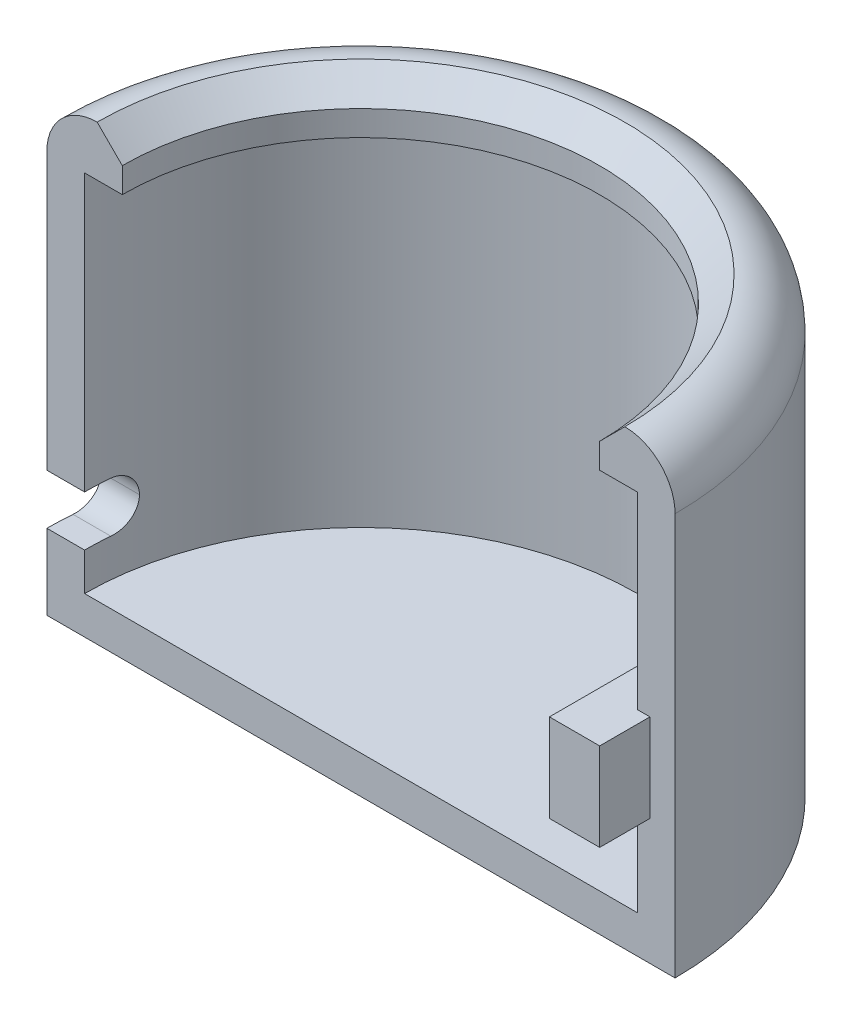
from build123d import *

# Parameters (mm, degrees)
R_VOLUTION1_ANGLE              = 180
CHANFREIN1_SIZE                = 1
CONG_1_R                       = 2
ENL_V_MAT_EXTRU_1_REACH        = 27.229
ESQUISSE4_W                    = 4
ESQUISSE4_H                    = 2
CONG_2_R                       = 1
BOSS_EXTRU_2_REACH             = 27.229
BOSS_EXTRU_2_END_RADIUS        = 11
ESQUISSE5_W                    = 2
ESQUISSE5_H                    = 3.5
BOSS_EXTRU_2_DIRECTION_2_DEPTH = 2


with BuildPart() as part:
    # Esquisse3 → Révolution1 (revolve)
    with BuildSketch(Plane.XY):
        Polygon((0, 0), (12.5, 0), (12.5, 18), (9.5, 18), (9.5, 16), (11, 16), (11, 1.5), (0, 1.5), align=None)
    revolve(axis=Axis((0, 0, 0), (0, 1, 0)), revolution_arc=R_VOLUTION1_ANGLE)

    # Chanfrein1
    chanfrein1_edges = [part.edges().sort_by_distance(p)[0] for p in [
        (0, 18, -9.5),
    ]]
    chamfer(chanfrein1_edges, length=CHANFREIN1_SIZE)

    # Congé1
    cong_1_edges = [part.edges().sort_by_distance(p)[0] for p in [
        (0, 18, -12.5),
    ]]
    fillet(cong_1_edges, radius=CONG_1_R - 0.0001)  # a hair under: the kernel refuses the full size

    # Esquisse4 → Enlèv. mat.-Extru.1 (cut, up to next)
    with BuildSketch(Plane(origin=(0, 0, 0), x_dir=(0, 0, -1), z_dir=(1, 0, 0)), mode=Mode.PRIVATE) as enl_v_mat_extru_1_sk1:
        with Locations((0, 4)):
            Rectangle(ESQUISSE4_W, ESQUISSE4_H)
    enl_v_mat_extru_1_tool1 = extrude(enl_v_mat_extru_1_sk1.sketch, amount=-ENL_V_MAT_EXTRU_1_REACH, mode=Mode.PRIVATE) & part.part
    add(enl_v_mat_extru_1_tool1.solids().sort_by_distance((0, 4, 0))[0], mode=Mode.SUBTRACT)

    # Congé2
    cong_2_edges = [part.edges().sort_by_distance(p)[0] for p in [
        (-11.577808253, 5, -2),
        (-11.577808253, 3, -2),
    ]]
    fillet(cong_2_edges, radius=CONG_2_R - 0.0001)  # a hair under: the kernel refuses the full size

    # Boss.-Extru.2: up to this cylinder (the profile starts inside it)
    boss_extru_2_end = Plane(origin=(0, 6.75, 0), z_dir=(0, -1, 0)) * Cylinder(BOSS_EXTRU_2_END_RADIUS, 77.458, mode=Mode.PRIVATE)
    # Esquisse5 → Boss.-Extru.2 (add, up to the surface)
    with BuildSketch(Plane.XY, mode=Mode.PRIVATE) as boss_extru_2_sk1:
        with Locations((10.5, 6.75)):
            Rectangle(ESQUISSE5_W, ESQUISSE5_H)
    boss_extru_2_tool1 = extrude(boss_extru_2_sk1.sketch, amount=-BOSS_EXTRU_2_REACH, mode=Mode.PRIVATE) & boss_extru_2_end
    add(boss_extru_2_tool1.solids().sort_by_distance((10.5, 6.75, 0))[0])

    # Esquisse5 → Boss.-Extru.2 direction 2 (add)
    with BuildSketch(Plane.XY):
        with Locations((10.5, 6.75)):
            Rectangle(ESQUISSE5_W, ESQUISSE5_H)
    extrude(amount=BOSS_EXTRU_2_DIRECTION_2_DEPTH)


solid = part.part
